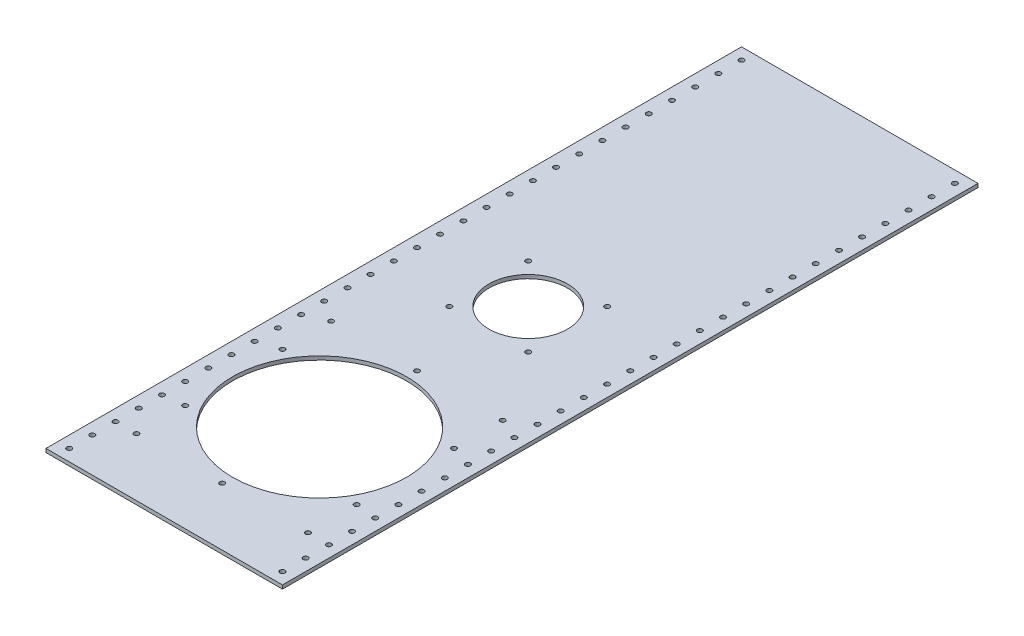
from build123d import *

# Parameters (mm, degrees)
SKETCH1_W           = 204
SKETCH1_H           = 600
SKETCH1_R           = 2.15
SKETCH1_R_2         = 2.125
SKETCH1_R_3         = 33.85
SKETCH1_R_4         = 75.125
BOSS_EXTRUDE1_DEPTH = 3.175


with BuildPart() as part:
    # Sketch1 → Boss-Extrude1 (new body)
    with BuildSketch(Plane(origin=(0, 0, 0), x_dir=(1, 0, 0), z_dir=(0, 1, 0))):
        with Locations((0, 92.549)):
            Rectangle(SKETCH1_W, SKETCH1_H)
        with Locations((92, 382.549)):
            Circle(SKETCH1_R, mode=Mode.SUBTRACT)
        with Locations((92, 362.549)):
            Circle(SKETCH1_R, mode=Mode.SUBTRACT)
        with Locations((92, 342.549)):
            Circle(SKETCH1_R, mode=Mode.SUBTRACT)
        with Locations((92, 322.549)):
            Circle(SKETCH1_R, mode=Mode.SUBTRACT)
        with Locations((92, 302.549)):
            Circle(SKETCH1_R, mode=Mode.SUBTRACT)
        with Locations((92, 282.549)):
            Circle(SKETCH1_R, mode=Mode.SUBTRACT)
        with Locations((92, 262.549)):
            Circle(SKETCH1_R, mode=Mode.SUBTRACT)
        with Locations((92, 242.549)):
            Circle(SKETCH1_R, mode=Mode.SUBTRACT)
        with Locations((92, 222.549)):
            Circle(SKETCH1_R, mode=Mode.SUBTRACT)
        with Locations((92, 202.549)):
            Circle(SKETCH1_R, mode=Mode.SUBTRACT)
        with Locations((92, 182.549)):
            Circle(SKETCH1_R, mode=Mode.SUBTRACT)
        with Locations((92, 162.549)):
            Circle(SKETCH1_R, mode=Mode.SUBTRACT)
        with Locations((92, 142.549)):
            Circle(SKETCH1_R, mode=Mode.SUBTRACT)
        with Locations((92, 122.549)):
            Circle(SKETCH1_R, mode=Mode.SUBTRACT)
        with Locations((92, 102.549)):
            Circle(SKETCH1_R, mode=Mode.SUBTRACT)
        with Locations((92, 82.549)):
            Circle(SKETCH1_R, mode=Mode.SUBTRACT)
        with Locations((92, 62.549)):
            Circle(SKETCH1_R, mode=Mode.SUBTRACT)
        with Locations((92, 42.549)):
            Circle(SKETCH1_R, mode=Mode.SUBTRACT)
        with Locations((92, 22.549)):
            Circle(SKETCH1_R, mode=Mode.SUBTRACT)
        with Locations((92, 2.549)):
            Circle(SKETCH1_R, mode=Mode.SUBTRACT)
        with Locations((92, -17.451)):
            Circle(SKETCH1_R, mode=Mode.SUBTRACT)
        with Locations((92, -37.451)):
            Circle(SKETCH1_R, mode=Mode.SUBTRACT)
        with Locations((92, -57.451)):
            Circle(SKETCH1_R, mode=Mode.SUBTRACT)
        with Locations((92, -77.451)):
            Circle(SKETCH1_R, mode=Mode.SUBTRACT)
        with Locations((92, -97.451)):
            Circle(SKETCH1_R, mode=Mode.SUBTRACT)
        with Locations((92, -117.451)):
            Circle(SKETCH1_R, mode=Mode.SUBTRACT)
        with Locations((92, -137.451)):
            Circle(SKETCH1_R, mode=Mode.SUBTRACT)
        with Locations((92, -157.451)):
            Circle(SKETCH1_R, mode=Mode.SUBTRACT)
        with Locations((92, -177.451)):
            Circle(SKETCH1_R, mode=Mode.SUBTRACT)
        with Locations((92, -197.451)):
            Circle(SKETCH1_R, mode=Mode.SUBTRACT)
        with Locations((-92, -197.451)):
            Circle(SKETCH1_R, mode=Mode.SUBTRACT)
        with Locations((-92, -177.451)):
            Circle(SKETCH1_R, mode=Mode.SUBTRACT)
        with Locations((-92, -157.451)):
            Circle(SKETCH1_R, mode=Mode.SUBTRACT)
        with Locations((-92, -137.451)):
            Circle(SKETCH1_R, mode=Mode.SUBTRACT)
        with Locations((-92, -117.451)):
            Circle(SKETCH1_R, mode=Mode.SUBTRACT)
        with Locations((-92, -97.451)):
            Circle(SKETCH1_R, mode=Mode.SUBTRACT)
        with Locations((-92, -77.451)):
            Circle(SKETCH1_R, mode=Mode.SUBTRACT)
        with Locations((-92, -57.451)):
            Circle(SKETCH1_R, mode=Mode.SUBTRACT)
        with Locations((-92, -37.451)):
            Circle(SKETCH1_R, mode=Mode.SUBTRACT)
        with Locations((-92, -17.451)):
            Circle(SKETCH1_R, mode=Mode.SUBTRACT)
        with Locations((-92, 2.549)):
            Circle(SKETCH1_R, mode=Mode.SUBTRACT)
        with Locations((-92, 22.549)):
            Circle(SKETCH1_R, mode=Mode.SUBTRACT)
        with Locations((-92, 42.549)):
            Circle(SKETCH1_R, mode=Mode.SUBTRACT)
        with Locations((-92, 62.549)):
            Circle(SKETCH1_R, mode=Mode.SUBTRACT)
        with Locations((-92, 82.549)):
            Circle(SKETCH1_R, mode=Mode.SUBTRACT)
        with Locations((-92, 102.549)):
            Circle(SKETCH1_R, mode=Mode.SUBTRACT)
        with Locations((-92, 122.549)):
            Circle(SKETCH1_R, mode=Mode.SUBTRACT)
        with Locations((-92, 142.549)):
            Circle(SKETCH1_R, mode=Mode.SUBTRACT)
        with Locations((-92, 162.549)):
            Circle(SKETCH1_R, mode=Mode.SUBTRACT)
        with Locations((-92, 182.549)):
            Circle(SKETCH1_R, mode=Mode.SUBTRACT)
        with Locations((-92, 202.549)):
            Circle(SKETCH1_R, mode=Mode.SUBTRACT)
        with Locations((-92, 222.549)):
            Circle(SKETCH1_R, mode=Mode.SUBTRACT)
        with Locations((-92, 242.549)):
            Circle(SKETCH1_R, mode=Mode.SUBTRACT)
        with Locations((-92, 262.549)):
            Circle(SKETCH1_R, mode=Mode.SUBTRACT)
        with Locations((-92, 282.549)):
            Circle(SKETCH1_R, mode=Mode.SUBTRACT)
        with Locations((-92, 302.549)):
            Circle(SKETCH1_R, mode=Mode.SUBTRACT)
        with Locations((-92, 322.549)):
            Circle(SKETCH1_R, mode=Mode.SUBTRACT)
        with Locations((-92, 342.549)):
            Circle(SKETCH1_R, mode=Mode.SUBTRACT)
        with Locations((-92, 362.549)):
            Circle(SKETCH1_R, mode=Mode.SUBTRACT)
        with Locations((-92, 382.549)):
            Circle(SKETCH1_R, mode=Mode.SUBTRACT)
        with Locations((-74, -157.451)):
            Circle(SKETCH1_R_2, mode=Mode.SUBTRACT)
        with Locations((-74, -115.451)):
            Circle(SKETCH1_R_2, mode=Mode.SUBTRACT)
        with Locations((0, -157.451)):
            Circle(SKETCH1_R_2, mode=Mode.SUBTRACT)
        with Locations((74, -157.451)):
            Circle(SKETCH1_R_2, mode=Mode.SUBTRACT)
        with Locations((74, -115.451)):
            Circle(SKETCH1_R_2, mode=Mode.SUBTRACT)
        with Locations((74, -31.451)):
            Circle(SKETCH1_R_2, mode=Mode.SUBTRACT)
        with Locations((74, 10.549)):
            Circle(SKETCH1_R_2, mode=Mode.SUBTRACT)
        with Locations((0, 10.549)):
            Circle(SKETCH1_R_2, mode=Mode.SUBTRACT)
        with Locations((-74, 10.549)):
            Circle(SKETCH1_R_2, mode=Mode.SUBTRACT)
        with Locations((-74, -31.451)):
            Circle(SKETCH1_R_2, mode=Mode.SUBTRACT)
        with Locations((0, 106.549)):
            Circle(SKETCH1_R_3, mode=Mode.SUBTRACT)
        with Locations((0, -73.451)):
            Circle(SKETCH1_R_4, mode=Mode.SUBTRACT)
        with Locations((-34, 72.549)):
            Circle(SKETCH1_R, mode=Mode.SUBTRACT)
        with Locations((34, 72.549)):
            Circle(SKETCH1_R, mode=Mode.SUBTRACT)
        with Locations((34, 140.549)):
            Circle(SKETCH1_R, mode=Mode.SUBTRACT)
        with Locations((-34, 140.549)):
            Circle(SKETCH1_R, mode=Mode.SUBTRACT)
    extrude(amount=BOSS_EXTRUDE1_DEPTH)


solid = part.part
